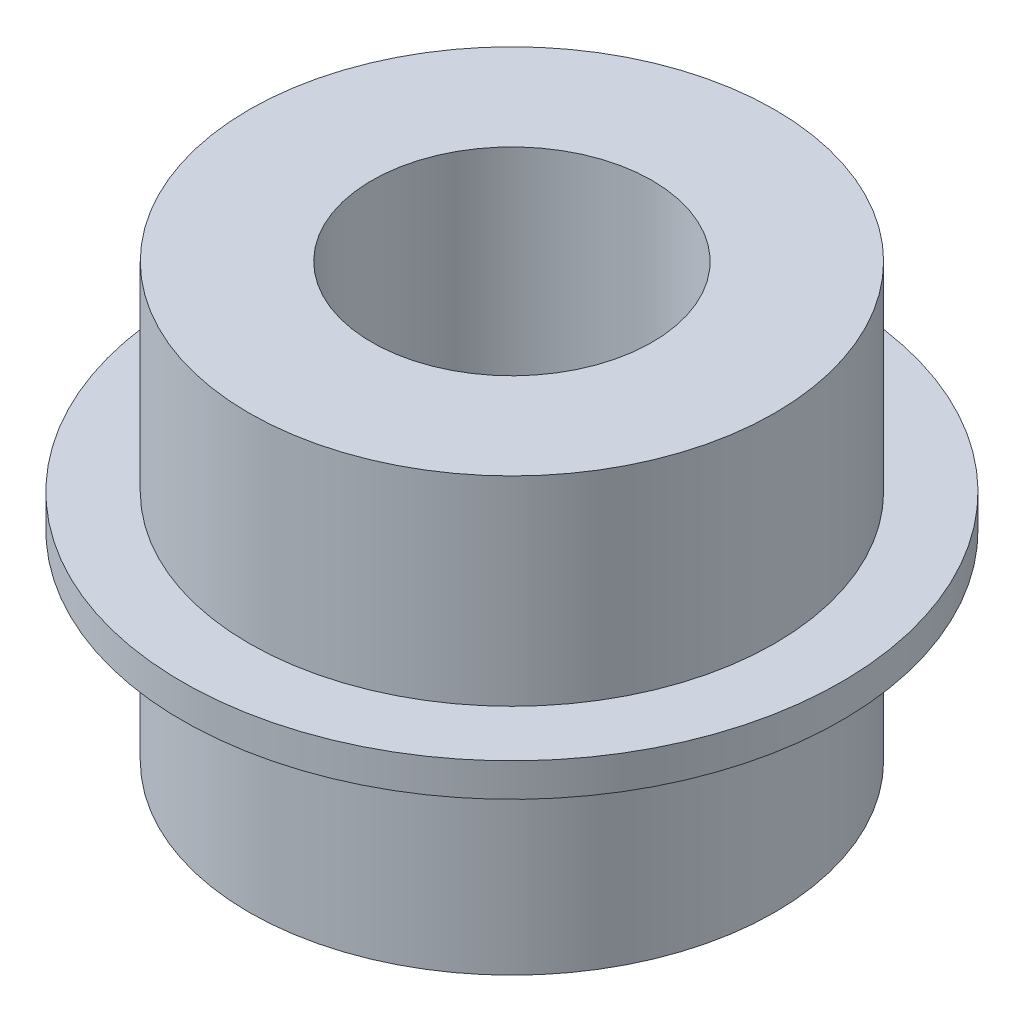
from build123d import *


with BuildPart() as part:
    # Sketch1 → Revolve1 (revolve)
    with BuildSketch(Plane.XY):
        Polygon((-4.2, -6.477), (-4.2, 6.477), (-7.874, 6.477), (-7.874, 0.5), (-9.874, 0.5), (-9.874, -0.5), (-7.874, -0.5), (-7.874, -6.477), align=None)
    revolve(axis=Axis((0, 0, 0), (0, 1, 0)))


solid = part.part
